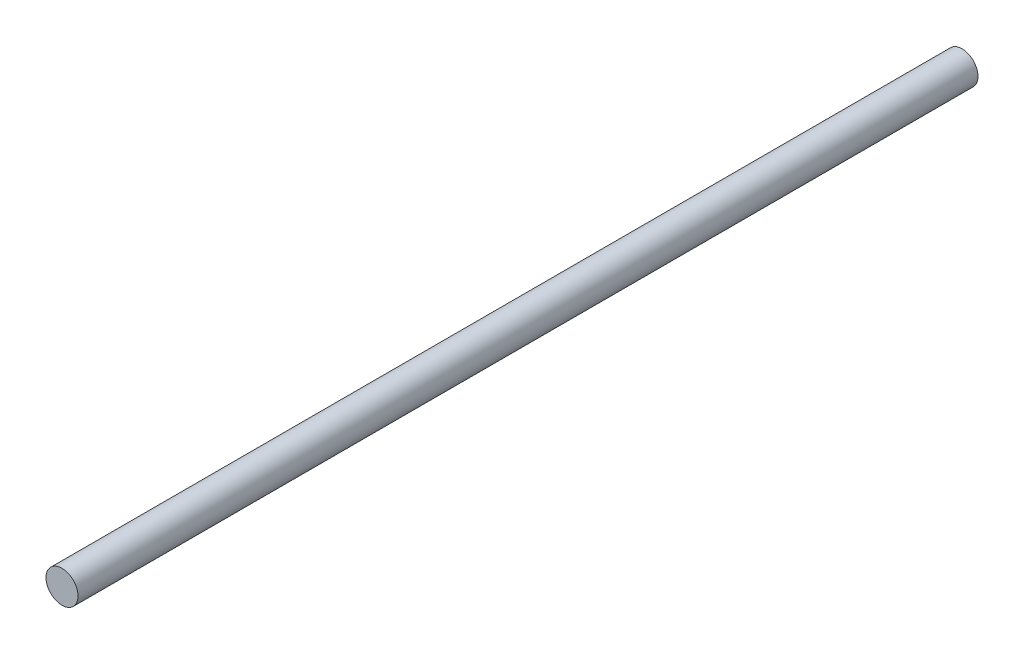
from build123d import *

# Parameters (mm, degrees)
BOSS_EXTRUDE1_OUTLINE_R = 6.35
BOSS_EXTRUDE1_DEPTH     = 356.873385235


# Read off the part's stored shape, not the designer's step: Boss-Extrude1
with BuildPart() as part:
    # Boss-Extrude1 outline → Boss-Extrude1 (new body)
    with BuildSketch(Plane.XY.offset(-22.86)):
        Circle(BOSS_EXTRUDE1_OUTLINE_R)
    extrude(amount=BOSS_EXTRUDE1_DEPTH)


solid = part.part
